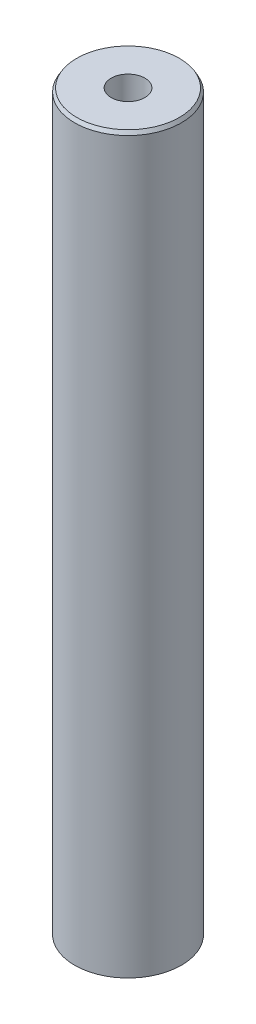
from build123d import *
from OCP.BRepFilletAPI import BRepFilletAPI_MakeChamfer

# Parameters (mm, degrees)
SKETCH1_R           = 40
BOSS_EXTRUDE1_DEPTH = 550.872729426
SKETCH2_R           = 12.649185327
CUT_EXTRUDE1_DEPTH  = 554.76959471
CHAMFER1_SIZE       = 2.704666141
CHAMFER1_SIZE2      = 1.561539724


with BuildPart() as part:
    # Sketch1 → Boss-Extrude1 (new body)
    with BuildSketch(Plane(origin=(0, 0, 0), x_dir=(1, 0, 0), z_dir=(0, 1, 0))):
        Circle(SKETCH1_R)
    extrude(amount=BOSS_EXTRUDE1_DEPTH)

    # Sketch2 → Cut-Extrude1 (cut, through all)
    with BuildSketch(Plane(origin=(0, 0, 0), x_dir=(1, 0, 0), z_dir=(0, 1, 0))):
        Circle(SKETCH2_R)
    extrude(amount=CUT_EXTRUDE1_DEPTH, mode=Mode.SUBTRACT)

    # Chamfer1: one chamfer whose edges measure the first distance from different faces: ONE call of the kernel's chamfer builder (chamfer() names one face for all edges)
    chamfer1_edges_1 = [part.edges().sort_by_distance(p)[0] for p in [
        (-40, 550.872729426, 0),
    ]]
    chamfer1_side_1 = [part.faces().sort_by_distance(p)[0] for p in [
        (-40, 275.436364713, 0),
    ]]
    chamfer1_edges_2 = [part.edges().sort_by_distance(p)[0] for p in [
        (-40, 0, 0),
    ]]
    chamfer1_side_2 = [part.faces().sort_by_distance(p)[0] for p in [
        (-38.86862915, 0, 0),
    ]]
    chamfer1 = BRepFilletAPI_MakeChamfer(part.part.solid().wrapped)
    for e in chamfer1_edges_1:
        chamfer1.Add(CHAMFER1_SIZE, CHAMFER1_SIZE2, e.wrapped, chamfer1_side_1[0].wrapped)  # the first distance lies on this face
    for e in chamfer1_edges_2:
        chamfer1.Add(CHAMFER1_SIZE, CHAMFER1_SIZE2, e.wrapped, chamfer1_side_2[0].wrapped)  # the first distance lies on this face
    add(Compound.cast(chamfer1.Shape()), mode=Mode.REPLACE)


solid = part.part
